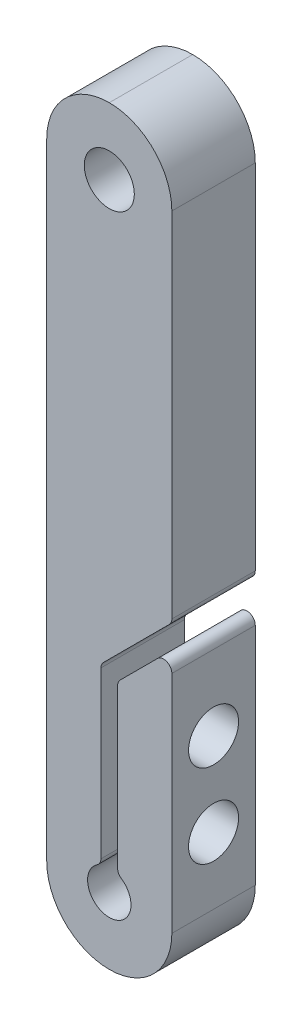
from build123d import *

# Parameters (mm, degrees)
ESQUISSE1_W             = 15
ESQUISSE1_H             = 90
BOSS_EXTRU_1_DEPTH      = 10
ESQUISSE2_R             = 3
ESQUISSE2_R_2           = 2.6
ENL_V_MAT_EXTRU_1_DEPTH = 10
CONG_1_R                = 7.5
ENL_V_MAT_EXTRU_2_DEPTH = 92.787798753
ESQUISSE4_R             = 2.1
ENL_V_MAT_EXTRU_3_DEPTH = 92.787798753
ESQUISSE5_R             = 3
ENL_V_MAT_EXTRU_4_DEPTH = 6.5
CONG_2_R                = 1


with BuildPart() as part:
    # Esquisse1 → Boss.-Extru.1 (new body)
    with BuildSketch(Plane.XY):
        with Locations((7.5, 45)):
            Rectangle(ESQUISSE1_W, ESQUISSE1_H)
    extrude(amount=BOSS_EXTRU_1_DEPTH)

    # Esquisse2 → Enlèv. mat.-Extru.1 (cut)
    with BuildSketch(Plane.XY.offset(10)):
        with Locations((7.5, 82)):
            Circle(ESQUISSE2_R)
        with Locations((7.5, 8)):
            Circle(ESQUISSE2_R_2)
    extrude(amount=-ENL_V_MAT_EXTRU_1_DEPTH, mode=Mode.SUBTRACT)

    # Congé1
    cong_1_edges = [part.edges().sort_by_distance(p)[0] for p in [
        (15, 90, 5),
        (0, 90, 5),
        (15, 0, 5),
        (0, 0, 5),
    ]]
    fillet(cong_1_edges, radius=CONG_1_R - 0.0001)  # a hair under: the kernel refuses the full size

    # Esquisse3 → Enlèv. mat.-Extru.2 (cut, through all)
    with BuildSketch(Plane.XY.offset(10)):
        Polygon((6.5, 10.4), (6.5, 31.228427125), (15, 39.728427125), (15, 36.9), (8.5, 30.4), (8.5, 10.4), align=None)
    extrude(amount=-ENL_V_MAT_EXTRU_2_DEPTH, mode=Mode.SUBTRACT)

    # Esquisse4 → Enlèv. mat.-Extru.3 (cut, through all)
    with BuildSketch(Plane(origin=(15, 0, 0), x_dir=(0, 0, -1), z_dir=(1, 0, 0))):
        with Locations((-5, 15.5)):
            Circle(ESQUISSE4_R)
        with Locations((-5, 25.5)):
            Circle(ESQUISSE4_R)
    extrude(amount=-ENL_V_MAT_EXTRU_3_DEPTH, mode=Mode.SUBTRACT)

    # Esquisse5 → Enlèv. mat.-Extru.4 (cut)
    with BuildSketch(Plane(origin=(15, 0, 0), x_dir=(0, 0, -1), z_dir=(1, 0, 0))):
        with Locations((-5, 25.5)):
            Circle(ESQUISSE5_R)
        with Locations((-5, 15.5)):
            Circle(ESQUISSE5_R)
    extrude(amount=-ENL_V_MAT_EXTRU_4_DEPTH, mode=Mode.SUBTRACT)

    # Congé2
    cong_2_edges = [part.edges().sort_by_distance(p)[0] for p in [
        (8.5, 10.4, 5),
        (6.5, 10.4, 5),
        (6.5, 31.228427125, 5),
        (15, 39.728427125, 5),
        (15, 36.9, 5),
        (8.5, 30.4, 5),
    ]]
    fillet(cong_2_edges, radius=CONG_2_R)


solid = part.part
